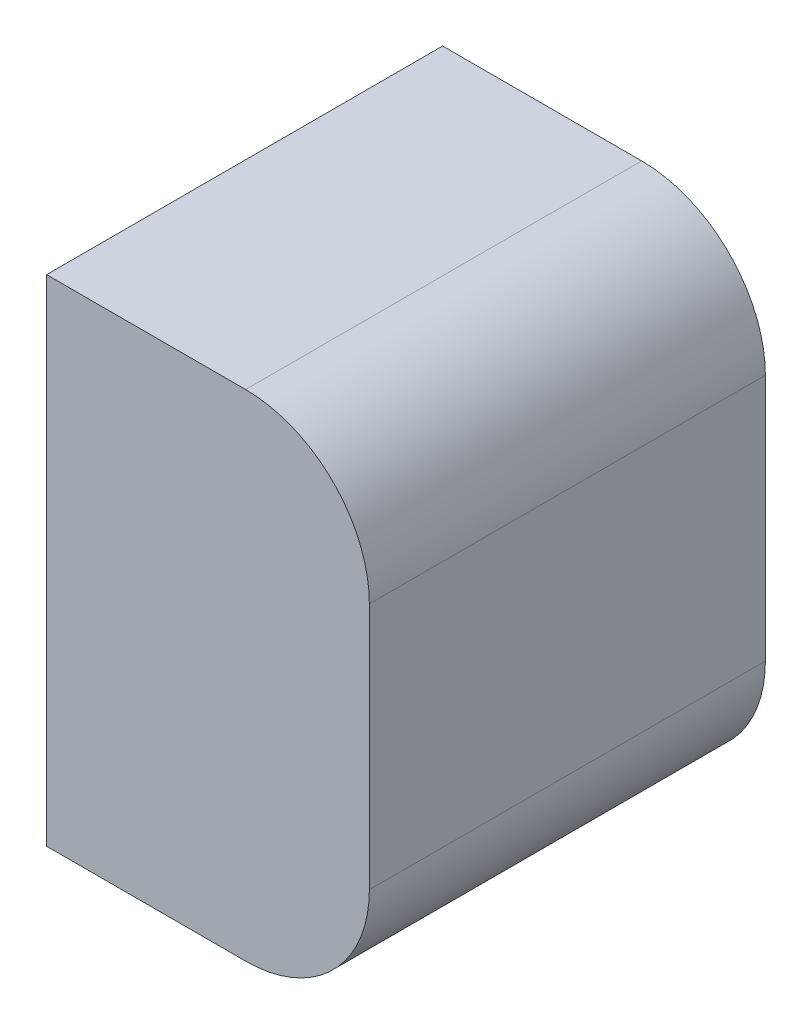
from build123d import *

# Parameters (mm, degrees)
BOSS_EXTRUDE1_DEPTH = 10


with BuildPart() as part:
    # Sketch1 → Boss-Extrude1 (new body)
    with BuildSketch(Plane.XY):
        with BuildLine():
            Line((-0.95, -6.25), (4.075, -6.25))
            ThreePointArc((4.075, -6.25), (6.284708691, -5.334708691), (7.2, -3.125))
            Line((7.2, -3.125), (7.2, 3.125))
            ThreePointArc((7.2, 3.125), (6.284708691, 5.334708691), (4.075, 6.25))
            Line((4.075, 6.25), (-0.95, 6.25))
            Line((-0.95, 6.25), (-0.95, -6.25))
        make_face()
    extrude(amount=BOSS_EXTRUDE1_DEPTH)


solid = part.part
